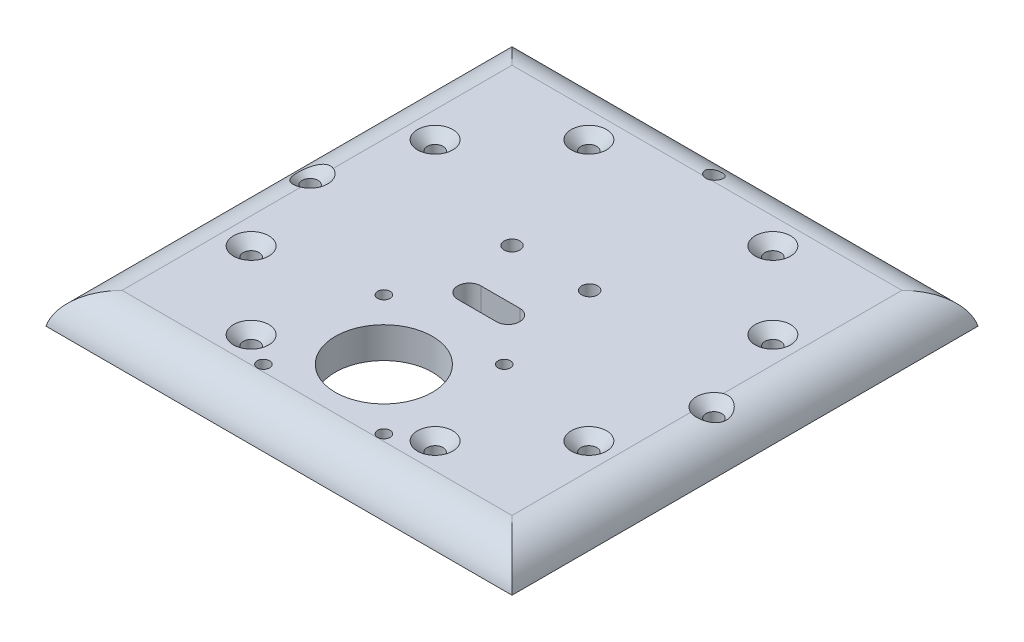
from build123d import *

# Parameters (mm, degrees)
SKETCH1_W                                           = 120
SKETCH1_H                                           = 120
BOSS_EXTRUDE1_DEPTH                                 = 8
SKETCH2_R                                           = 12.5
SKETCH2_R_2                                         = 1.6
CUT_EXTRUDE1_DEPTH                                  = 86.229103011
SKETCH3_R                                           = 2.05
CUT_EXTRUDE2_DEPTH                                  = 86.229103011
CIRPATTERN1_COUNT                                   = 4
SKETCH4_R                                           = 2.05
CUT_EXTRUDE3_DEPTH                                  = 86.229103011
SKETCH5_R                                           = 2.05
CUT_EXTRUDE4_DEPTH                                  = 86.229103011
SKETCH6_W                                           = 8
SKETCH6_H                                           = 20
BOSS_EXTRUDE2_DEPTH                                 = 18
CHAMFER1_SIZE                                       = 5
SKETCH7_R                                           = 1.6
CUT_EXTRUDE5_DEPTH                                  = 93.455394651
CSK_FOR_M4_COUNTERSUNK_FLAT_HEAD_SCREW1_D           = 4.1
CSK_FOR_M4_COUNTERSUNK_FLAT_HEAD_SCREW1_DEPTH       = 7.999
CSK_FOR_M4_COUNTERSUNK_FLAT_HEAD_SCREW1_CSINK_D     = 9.1
CSK_FOR_M4_COUNTERSUNK_FLAT_HEAD_SCREW1_CSINK_ANGLE = 90
CSK_FOR_M4_COUNTERSUNK_FLAT_HEAD_SCREW1_TIP         = 1.231764269
FILLET1_R                                           = 10


with BuildPart() as part:
    # Sketch1 → Boss-Extrude1 (new body)
    with BuildSketch(Plane(origin=(0, 0, 0), x_dir=(1, 0, 0), z_dir=(0, 1, 0))):
        Rectangle(SKETCH1_W, SKETCH1_H)
    extrude(amount=BOSS_EXTRUDE1_DEPTH)

    # Sketch2 → Cut-Extrude1 (cut, through all)
    with BuildSketch(Plane(origin=(0, 8, 0), x_dir=(1, 0, 0), z_dir=(0, 1, 0))):
        with Locations(Location((0, -33, 0), (0, 0, 270))):
            Circle(SKETCH2_R)
        with Locations(Location((-15.5, -48.5, 0), (0, 0, 270))):
            Circle(SKETCH2_R_2)
        with Locations(Location((15.5, -48.5, 0), (0, 0, 270))):
            Circle(SKETCH2_R_2)
        with Locations(Location((15.5, -17.5, 0), (0, 0, 270))):
            Circle(SKETCH2_R_2)
        with Locations(Location((-15.5, -17.5, 0), (0, 0, 270))):
            Circle(SKETCH2_R_2)
    extrude(amount=-CUT_EXTRUDE1_DEPTH, mode=Mode.SUBTRACT)

    # Sketch3 → Cut-Extrude2 (cut, through all)
    with BuildSketch(Plane(origin=(0, 8, 0), x_dir=(1, 0, 0), z_dir=(0, 1, 0))):
        with Locations(Location((-43.487067043, -23.68807717, 0), (0, 0, 270))):
            Circle(SKETCH3_R)
        with Locations(Location((-23.68807717, -43.487067043, 0), (0, 0, 270))):
            Circle(SKETCH3_R)
    cut_extrude2 = extrude(amount=-CUT_EXTRUDE2_DEPTH, mode=Mode.SUBTRACT)

    # CirPattern1: Cut-Extrude2 ×4 about axis
    cirpattern1_axis = Axis((0, 0, 0), (0, 1, 0))
    for i in range(1, CIRPATTERN1_COUNT):
        add(cut_extrude2.rotate(cirpattern1_axis, i * 360 / CIRPATTERN1_COUNT), mode=Mode.SUBTRACT)

    # Sketch4 → Cut-Extrude3 (cut, through all)
    with BuildSketch(Plane(origin=(0, 8, 0), x_dir=(1, 0, 0), z_dir=(0, 1, 0))):
        with Locations(Location((-52, 0, 0), (0, 0, 270))):
            Circle(SKETCH4_R)
        with Locations(Location((52, 0, 0), (0, 0, 270))):
            Circle(SKETCH4_R)
        with Locations(Location((0, 52, 0), (0, 0, 270))):
            Circle(SKETCH4_R)
    extrude(amount=-CUT_EXTRUDE3_DEPTH, mode=Mode.SUBTRACT)

    # Sketch5 → Cut-Extrude4 (cut, through all)
    with BuildSketch(Plane(origin=(0, 8, 0), x_dir=(1, 0, 0), z_dir=(0, 1, 0))):
        with Locations(Location((-10, 10, 0), (0, 0, 270))):
            Circle(SKETCH5_R)
        with Locations(Location((10, 10, 0), (0, 0, 270))):
            Circle(SKETCH5_R)
        with BuildLine():
            Line((-5, -3), (5, -3))
            ThreePointArc((5, -3), (8, -6), (5, -9))
            Line((5, -9), (-5, -9))
            ThreePointArc((-5, -9), (-8, -6), (-5, -3))
        make_face()
    extrude(amount=-CUT_EXTRUDE4_DEPTH, mode=Mode.SUBTRACT)

    # Sketch6 → Boss-Extrude2 (add)
    with BuildSketch(Plane.XZ):
        with Locations((4, -28)):
            Rectangle(SKETCH6_W, SKETCH6_H)
    extrude(amount=BOSS_EXTRUDE2_DEPTH)

    # Chamfer1
    chamfer1_edges = [part.edges().sort_by_distance(p)[0] for p in [
        (8, 0, -28),
    ]]
    chamfer(chamfer1_edges, length=CHAMFER1_SIZE)

    # Sketch7 → Cut-Extrude5 (cut, through all)
    with BuildSketch(Plane(origin=(8, 0, 0), x_dir=(0, 0, -1), z_dir=(1, 0, 0))):
        with Locations((23.25, -10.5)):
            Circle(SKETCH7_R)
        with Locations((32.75, -10.5)):
            Circle(SKETCH7_R)
    extrude(amount=-CUT_EXTRUDE5_DEPTH, mode=Mode.SUBTRACT)

    # CSK for M4 Countersunk Flat Head Screw1
    with Locations(Plane(origin=(-52, 8, 0), x_dir=(0, 0, 1), z_dir=(0, 1, 0))):
        with Locations((0, 0), (23.68807717, 8.512932957), (43.487067043, 28.31192283), (43.487067043, 75.68807717), (23.68807717, 95.487067043), (0, 104), (-23.68807717, 95.487067043), (-43.487067043, 75.68807717), (-43.487067043, 28.31192283), (-23.68807717, 8.512932957)):
            CounterSinkHole(CSK_FOR_M4_COUNTERSUNK_FLAT_HEAD_SCREW1_D / 2, CSK_FOR_M4_COUNTERSUNK_FLAT_HEAD_SCREW1_CSINK_D / 2, depth=CSK_FOR_M4_COUNTERSUNK_FLAT_HEAD_SCREW1_DEPTH, counter_sink_angle=CSK_FOR_M4_COUNTERSUNK_FLAT_HEAD_SCREW1_CSINK_ANGLE)
            with Locations((0, 0, -(CSK_FOR_M4_COUNTERSUNK_FLAT_HEAD_SCREW1_DEPTH + CSK_FOR_M4_COUNTERSUNK_FLAT_HEAD_SCREW1_TIP / 2))):  # 118° drill point
                Cone(0, CSK_FOR_M4_COUNTERSUNK_FLAT_HEAD_SCREW1_D / 2, CSK_FOR_M4_COUNTERSUNK_FLAT_HEAD_SCREW1_TIP, mode=Mode.SUBTRACT)

    # Fillet1
    # the kernel refuses this fillet: 10 mm, written as the material it takes off along each edge
    with BuildSketch(Plane(origin=(-84.494897428, 8, -60), x_dir=(0, 0, 1), z_dir=(1, 0, 0)), Plane(origin=(60, 8, -84.494897428), x_dir=(-1, 0, 0), z_dir=(0, 0, 1)), Plane(origin=(-60, 8, 84.494897428), x_dir=(1, 0, 0), z_dir=(0, 0, -1)), Plane(origin=(84.494897428, 8, 60), x_dir=(0, 0, -1), z_dir=(-1, 0, 0))) as fillet1_piece_1:
        with BuildLine():
            CenterArc((9.797958971, 10), FILLET1_R, 191.536959033, 78.463040967)
            Line((0, 8), (0, 0))
            Line((0, 0), (9.797958971, 0))
        make_face()
    extrude(amount=168.989794856, mode=Mode.SUBTRACT)


solid = part.part
